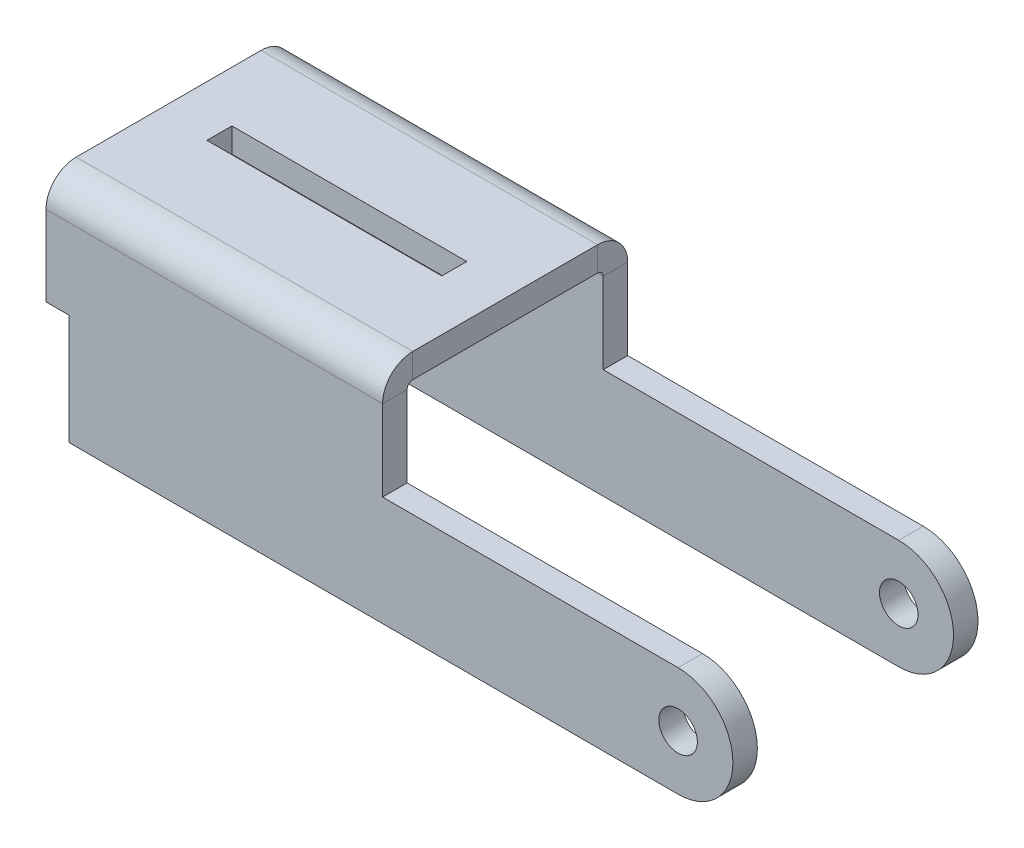
from build123d import *

# Parameters (mm, degrees)
SALIENTE_EXTRUIR1_DEPTH         = 43.688
CROQUIS2_W                      = 3
CROQUIS2_H                      = 14.32
CORTAR_EXTRUIR1_DEPTH           = 43.688
CROQUIS3_W                      = 30.48
CROQUIS3_H                      = 3.2375
CORTAR_EXTRUIR2_DEPTH           = 43.688
CROQUIS4_R                      = 2.5
SALIENTE_EXTRUIR2_DEPTH         = 31.8125
CROQUIS5_W                      = 45.466
CROQUIS5_H                      = 25.4625
CORTAR_EXTRUIR3_DEPTH           = 43.688
DESPLEGAR_PLIEGUES5_OUTLINE_W   = 91
DESPLEGAR_PLIEGUES5_OUTLINE_H   = 3.175
DESPLEGAR_PLIEGUES5_DEPTH       = 25.4625
DESPLEGAR_START                 = 25.4625
DESPLEGAR_PLIEGUES5_2_OUTLINE_R = 2.5
DESPLEGAR_PLIEGUES5_2_DEPTH     = 3.175
PROCESAR_START                  = -27.639987743
PROCESAR_PLIEGUES5_OUTLINE_W    = 43.688
PROCESAR_PLIEGUES5_OUTLINE_H    = 3.175
PROCESAR_PLIEGUES5_DEPTH        = 24.464987743
PROCESAR_START_2                = 28.6375
PROCESAR_PLIEGUES5_2_OUTLINE_W  = 43.688
PROCESAR_PLIEGUES5_2_OUTLINE_H  = 3.175
PROCESAR_PLIEGUES5_2_DEPTH      = 24.464987743
PROCESAR_START_3                = -3.175
PROCESAR_PLIEGUES5_3_OUTLINE_R  = 2.5
PROCESAR_PLIEGUES5_3_DEPTH      = 3.9116
PROCESAR_START_4                = 24.7259
PROCESAR_PLIEGUES5_4_OUTLINE_R  = 2.5
PROCESAR_PLIEGUES5_4_DEPTH      = 3.9116
PROCESAR_PLIEGUES5_5_OUTLINE_W  = 3.175
PROCESAR_PLIEGUES5_5_OUTLINE_H  = 14.224
PROCESAR_PLIEGUES5_5_DEPTH      = 90


with BuildPart() as part:
    # Croquis1 → Saliente-Extruir1 (new body)
    with BuildSketch(Plane(origin=(0, 0, 0), x_dir=(0, 0, -1), z_dir=(1, 0, 0))):
        Polygon((-28.6375, 0), (-28.6375, 28.6375), (3.175, 28.6375), (3.175, 0), (0, 0), (0, 25.4625), (-25.4625, 25.4625), (-25.4625, 0), align=None)
    extrude(amount=SALIENTE_EXTRUIR1_DEPTH)

    # Croquis2 → Cortar-Extruir1 (cut)
    with BuildSketch(Plane.XY.offset(28.6375)):
        with Locations((1.5, 7.16)):
            Rectangle(CROQUIS2_W, CROQUIS2_H)
    extrude(amount=-CORTAR_EXTRUIR1_DEPTH, mode=Mode.SUBTRACT)

    # Croquis3 → Cortar-Extruir2 (cut)
    with BuildSketch(Plane(origin=(0, 28.6375, 0), x_dir=(1, 0, 0), z_dir=(0, 1, 0))):
        with Locations((21.844, -12.73125)):
            Rectangle(CROQUIS3_W, CROQUIS3_H)
    extrude(amount=-CORTAR_EXTRUIR2_DEPTH, mode=Mode.SUBTRACT)

    # Croquis4 → Saliente-Extruir2 (add)
    with BuildSketch(Plane.XY.offset(28.6375)):
        with BuildLine():
            Line((43.688, 14.224), (82.042, 14.224))
            ThreePointArc((82.042, 14.224), (89.154, 7.112), (82.042, 0))
            Line((82.042, 0), (43.688, 0))
            Line((43.688, 0), (43.688, 14.224))
        make_face()
        with Locations((82.042, 7.112)):
            Circle(CROQUIS4_R, mode=Mode.SUBTRACT)
    extrude(amount=-SALIENTE_EXTRUIR2_DEPTH)

    # Croquis5 → Cortar-Extruir3 (cut)
    with BuildSketch(Plane(origin=(0, 14.224, 0), x_dir=(1, 0, 0), z_dir=(0, 1, 0))):
        with Locations((66.421, -12.73125)):
            Rectangle(CROQUIS5_W, CROQUIS5_H)
    extrude(amount=-CORTAR_EXTRUIR3_DEPTH, mode=Mode.SUBTRACT)

    # Desplegar pliegues5: read off the stored shape, not the designer's step
    # Desplegar pliegues5 outline → Desplegar pliegues5 (cut)
    with BuildSketch(Plane(origin=(0, 0, 0), x_dir=(1, 0, 0), z_dir=(0, 1, 0))):
        with Locations((45.5, -27.05)):
            Rectangle(DESPLEGAR_PLIEGUES5_OUTLINE_W, DESPLEGAR_PLIEGUES5_OUTLINE_H)
        with Locations((45.5, 1.5875)):
            Rectangle(DESPLEGAR_PLIEGUES5_OUTLINE_W, DESPLEGAR_PLIEGUES5_OUTLINE_H)
    extrude(amount=DESPLEGAR_PLIEGUES5_DEPTH, mode=Mode.SUBTRACT)

    # Desplegar pliegues5 2 outline → Desplegar pliegues5 2 (add)
    # profile 1 of 2: a face of its own
    with BuildSketch(Plane(origin=(0, 0, 0), x_dir=(1, 0, 0), z_dir=(0, 1, 0)).offset(DESPLEGAR_START)):
        with BuildLine():
            Line((0, -28.6375), (0, -38.782487743))
            Line((0, -38.782487743), (3, -38.782487743))
            Line((3, -38.782487743), (3, -53.102487743))
            Line((3, -53.102487743), (82.042, -53.102487743))
            ThreePointArc((82.042, -53.102487743), (89.154, -45.990487743), (82.042, -38.878487743))
            Line((82.042, -38.878487743), (43.688, -38.878487743))
            Line((43.688, -38.878487743), (43.688, -28.6375))
            Line((43.688, -28.6375), (0, -28.6375))
        make_face()
        with Locations((82.042, -45.990487743)):
            Circle(DESPLEGAR_PLIEGUES5_2_OUTLINE_R, mode=Mode.SUBTRACT)
    # profile 2 of 2: a face of its own
    with BuildSketch(Plane(origin=(0, 0, 0), x_dir=(1, 0, 0), z_dir=(0, 1, 0)).offset(DESPLEGAR_START)):
        with BuildLine():
            Line((3, 27.639987743), (3, 13.319987743))
            Line((3, 13.319987743), (0, 13.319987743))
            Line((0, 13.319987743), (0, 3.175))
            Line((0, 3.175), (43.688, 3.175))
            Line((43.688, 3.175), (43.688, 13.415987743))
            Line((43.688, 13.415987743), (82.042, 13.415987743))
            ThreePointArc((82.042, 13.415987743), (89.154, 20.527987743), (82.042, 27.639987743))
            Line((82.042, 27.639987743), (3, 27.639987743))
        make_face()
        with Locations((82.042, 20.527987743)):
            Circle(DESPLEGAR_PLIEGUES5_2_OUTLINE_R, mode=Mode.SUBTRACT)
    extrude(amount=DESPLEGAR_PLIEGUES5_2_DEPTH)

    # Procesar pliegues5: read off the stored shape, not the designer's step
    # Procesar pliegues5 outline → Procesar pliegues5 (cut)
    with BuildSketch(Plane.XY.offset(PROCESAR_START)):
        with Locations((21.844, 27.05)):
            Rectangle(PROCESAR_PLIEGUES5_OUTLINE_W, PROCESAR_PLIEGUES5_OUTLINE_H)
    extrude(amount=PROCESAR_PLIEGUES5_DEPTH, mode=Mode.SUBTRACT)

    # Procesar pliegues5 2 outline → Procesar pliegues5 2 (cut)
    with BuildSketch(Plane.XY.offset(PROCESAR_START_2)):
        with Locations((21.844, 27.05)):
            Rectangle(PROCESAR_PLIEGUES5_2_OUTLINE_W, PROCESAR_PLIEGUES5_2_OUTLINE_H)
    extrude(amount=PROCESAR_PLIEGUES5_2_DEPTH, mode=Mode.SUBTRACT)

    # Procesar pliegues5 3 outline → Procesar pliegues5 3 (add)
    with BuildSketch(Plane.XY.offset(PROCESAR_START_3)):
        with BuildLine():
            Line((3, 14.32), (3, 0))
            Line((3, 0), (82.042, 0))
            ThreePointArc((82.042, 0), (89.154, 7.112), (82.042, 14.224))
            Line((82.042, 14.224), (43.688, 14.224))
            Line((43.688, 14.224), (43.688, 25.4625))
            Line((43.688, 25.4625), (0, 25.4625))
            Line((0, 25.4625), (0, 14.32))
            Line((0, 14.32), (3, 14.32))
        make_face()
        with Locations((82.042, 7.112)):
            Circle(PROCESAR_PLIEGUES5_3_OUTLINE_R, mode=Mode.SUBTRACT)
    extrude(amount=PROCESAR_PLIEGUES5_3_DEPTH)

    # Procesar pliegues5 4 outline → Procesar pliegues5 4 (add)
    with BuildSketch(Plane.XY.offset(PROCESAR_START_4)):
        with BuildLine():
            Line((3, 14.32), (3, 0))
            Line((3, 0), (82.042, 0))
            ThreePointArc((82.042, 0), (89.154, 7.112), (82.042, 14.224))
            Line((82.042, 14.224), (43.688, 14.224))
            Line((43.688, 14.224), (43.688, 25.4625))
            Line((43.688, 25.4625), (0, 25.4625))
            Line((0, 25.4625), (0, 14.32))
            Line((0, 14.32), (3, 14.32))
        make_face()
        with Locations((82.042, 7.112)):
            Circle(PROCESAR_PLIEGUES5_4_OUTLINE_R, mode=Mode.SUBTRACT)
    extrude(amount=PROCESAR_PLIEGUES5_4_DEPTH)

    # Procesar pliegues5 5 outline → Procesar pliegues5 5 (cut)
    with BuildSketch(Plane.YZ):
        with BuildLine():
            Line((0, 0.7366), (0, 0))
            Line((0, 0), (24.7259, 0))
            ThreePointArc((24.7259, 0), (25.246754855, 0.215745145), (25.4625, 0.7366))
            Line((25.4625, 0.7366), (0, 0.7366))
        make_face()
        with BuildLine():
            ThreePointArc((24.7259, 28.6375), (27.491818885, 27.491818885), (28.6375, 24.7259))
            Line((28.6375, 24.7259), (28.6375, 28.6375))
            Line((28.6375, 28.6375), (24.7259, 28.6375))
        make_face()
        with BuildLine():
            ThreePointArc((28.6375, 0.7366), (27.491818885, -2.029318885), (24.7259, -3.175))
            Line((24.7259, -3.175), (28.6375, -3.175))
            Line((28.6375, -3.175), (28.6375, 0.7366))
        make_face()
        with BuildLine():
            ThreePointArc((25.4625, 24.7259), (25.246754855, 25.246754855), (24.7259, 25.4625))
            Line((24.7259, 25.4625), (0, 25.4625))
            Line((0, 25.4625), (0, 24.7259))
            Line((0, 24.7259), (25.4625, 24.7259))
        make_face()
        with Locations((27.05, 45.990487743)):
            Rectangle(PROCESAR_PLIEGUES5_5_OUTLINE_W, PROCESAR_PLIEGUES5_5_OUTLINE_H)
        with Locations((27.05, -20.527987743)):
            Rectangle(PROCESAR_PLIEGUES5_5_OUTLINE_W, PROCESAR_PLIEGUES5_5_OUTLINE_H)
    extrude(amount=PROCESAR_PLIEGUES5_5_DEPTH, mode=Mode.SUBTRACT)


solid = part.part
